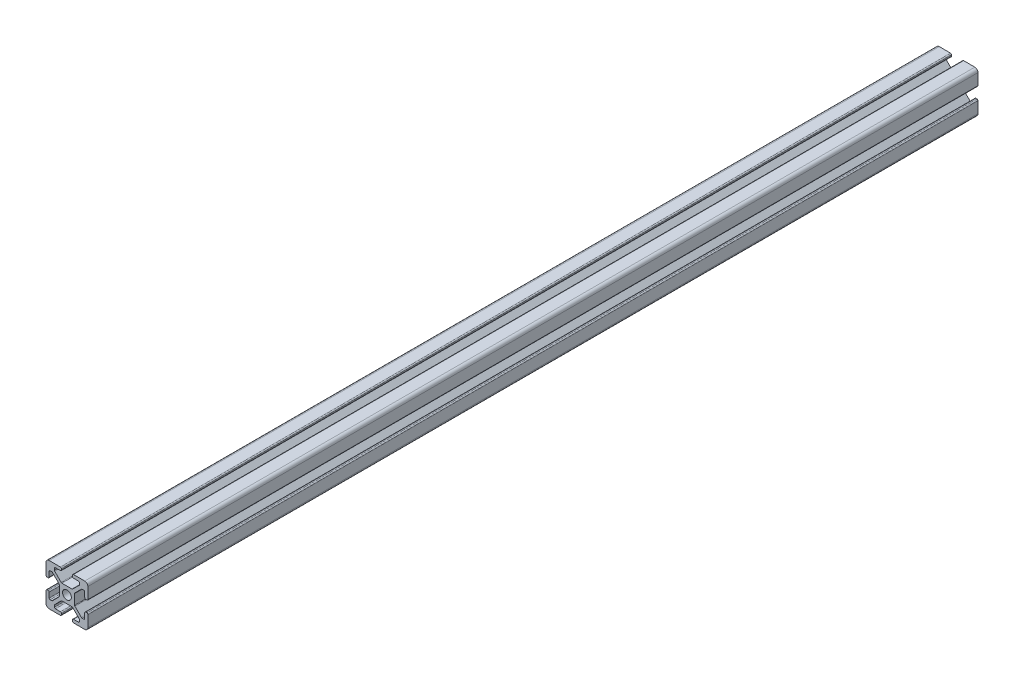
from build123d import *

# Parameters (mm, degrees)
SKETCH1_W           = 20
SKETCH1_H           = 20
BOSS_EXTRUDE1_DEPTH = 425
CUT_EXTRUDE1_DEPTH  = 426.23522902
FILLET1_R           = 0.5
CIRPATTERN1_START   = -425
CIRPATTERN1_DEPTH   = 425
FILLET2_R           = 1.5
SKETCH3_R           = 2.095
CUT_EXTRUDE2_DEPTH  = 426.23522902
FILLET3_R           = 0.5


# Read off the part's stored shape, not the designer's step: CirPattern1
with BuildPart() as part:
    # Sketch1 → Boss-Extrude1 (new body)
    with BuildSketch(Plane.XY):
        Rectangle(SKETCH1_W, SKETCH1_H)
    extrude(amount=-BOSS_EXTRUDE1_DEPTH)

    # Sketch2 → Cut-Extrude1 (cut, through all)
    with BuildSketch(Plane.XY):
        Polygon((0, 10), (-2.63, 10), (-2.63, 8.5), (-5.995, 8.5), (-5.995, 7.055660172), (-2.594339828, 3.655), (2.594339828, 3.655), (5.995, 7.055660172), (5.995, 8.5), (2.63, 8.5), (2.63, 10), align=None)
    extrude(amount=-CUT_EXTRUDE1_DEPTH, mode=Mode.SUBTRACT)

    # Fillet1
    fillet1_edges = [part.edges().sort_by_distance(p)[0] for p in [
        (2.63, 10, -212.5),
        (2.63, 8.5, -212.5),
        (5.995, 8.5, -212.5),
        (5.995, 7.055660172, -212.5),
        (2.594339828, 3.655, -212.5),
        (-2.594339828, 3.655, -212.5),
        (-5.995, 7.055660172, -212.5),
        (-5.995, 8.5, -212.5),
        (-2.63, 8.5, -212.5),
        (-2.63, 10, -212.5),
    ]]
    fillet(fillet1_edges, radius=FILLET1_R)

    # CirPattern1 outline → CirPattern1 (cut)
    with BuildSketch(Plane.XY.offset(CIRPATTERN1_START)):
        with BuildLine():
            Line((-2.63, -10), (2.63, -10))
            Line((2.63, -10), (2.63, -9))
            ThreePointArc((2.63, -9), (2.776446609, -8.646446609), (3.13, -8.5))
            Line((3.13, -8.5), (5.495, -8.5))
            ThreePointArc((5.495, -8.5), (5.848553391, -8.353553391), (5.995, -8))
            Line((5.995, -8), (5.995, -7.262766953))
            ThreePointArc((5.995, -7.262766953), (5.956939766, -7.071425237), (5.848553391, -6.909213562))
            Line((5.848553391, -6.909213562), (2.740786438, -3.801446609))
            ThreePointArc((2.740786438, -3.801446609), (2.578574763, -3.693060234), (2.387233047, -3.655))
            Line((2.387233047, -3.655), (-2.387233047, -3.655))
            ThreePointArc((-2.387233047, -3.655), (-2.578574763, -3.693060234), (-2.740786438, -3.801446609))
            Line((-2.740786438, -3.801446609), (-5.848553391, -6.909213562))
            ThreePointArc((-5.848553391, -6.909213562), (-5.956939766, -7.071425237), (-5.995, -7.262766953))
            Line((-5.995, -7.262766953), (-5.995, -8))
            ThreePointArc((-5.995, -8), (-5.848553391, -8.353553391), (-5.495, -8.5))
            Line((-5.495, -8.5), (-3.13, -8.5))
            ThreePointArc((-3.13, -8.5), (-2.776446609, -8.646446609), (-2.63, -9))
            Line((-2.63, -9), (-2.63, -10))
        make_face()
        with BuildLine():
            Line((-10, 2.63), (-10, -2.63))
            Line((-10, -2.63), (-9, -2.63))
            ThreePointArc((-9, -2.63), (-8.646446609, -2.776446609), (-8.5, -3.13))
            Line((-8.5, -3.13), (-8.5, -5.495))
            ThreePointArc((-8.5, -5.495), (-8.353553391, -5.848553391), (-8, -5.995))
            Line((-8, -5.995), (-7.262766953, -5.995))
            ThreePointArc((-7.262766953, -5.995), (-7.071425237, -5.956939766), (-6.909213562, -5.848553391))
            Line((-6.909213562, -5.848553391), (-3.801446609, -2.740786438))
            ThreePointArc((-3.801446609, -2.740786438), (-3.693060234, -2.578574763), (-3.655, -2.387233047))
            Line((-3.655, -2.387233047), (-3.655, 2.387233047))
            ThreePointArc((-3.655, 2.387233047), (-3.693060234, 2.578574763), (-3.801446609, 2.740786438))
            Line((-3.801446609, 2.740786438), (-6.909213562, 5.848553391))
            ThreePointArc((-6.909213562, 5.848553391), (-7.071425237, 5.956939766), (-7.262766953, 5.995))
            Line((-7.262766953, 5.995), (-8, 5.995))
            ThreePointArc((-8, 5.995), (-8.353553391, 5.848553391), (-8.5, 5.495))
            Line((-8.5, 5.495), (-8.5, 3.13))
            ThreePointArc((-8.5, 3.13), (-8.646446609, 2.776446609), (-9, 2.63))
            Line((-9, 2.63), (-10, 2.63))
        make_face()
        with BuildLine():
            Line((9, -2.63), (10, -2.63))
            Line((10, -2.63), (10, 2.63))
            Line((10, 2.63), (9, 2.63))
            ThreePointArc((9, 2.63), (8.646446609, 2.776446609), (8.5, 3.13))
            Line((8.5, 3.13), (8.5, 5.495))
            ThreePointArc((8.5, 5.495), (8.353553391, 5.848553391), (8, 5.995))
            Line((8, 5.995), (7.262766953, 5.995))
            ThreePointArc((7.262766953, 5.995), (7.071425237, 5.956939766), (6.909213562, 5.848553391))
            Line((6.909213562, 5.848553391), (3.801446609, 2.740786438))
            ThreePointArc((3.801446609, 2.740786438), (3.693060234, 2.578574763), (3.655, 2.387233047))
            Line((3.655, 2.387233047), (3.655, -2.387233047))
            ThreePointArc((3.655, -2.387233047), (3.693060234, -2.578574763), (3.801446609, -2.740786438))
            Line((3.801446609, -2.740786438), (6.909213562, -5.848553391))
            ThreePointArc((6.909213562, -5.848553391), (7.071425237, -5.956939766), (7.262766953, -5.995))
            Line((7.262766953, -5.995), (8, -5.995))
            ThreePointArc((8, -5.995), (8.353553391, -5.848553391), (8.5, -5.495))
            Line((8.5, -5.495), (8.5, -3.13))
            ThreePointArc((8.5, -3.13), (8.646446609, -2.776446609), (9, -2.63))
        make_face()
    extrude(amount=CIRPATTERN1_DEPTH, mode=Mode.SUBTRACT)

    # Fillet2
    fillet2_edges = [part.edges().sort_by_distance(p)[0] for p in [
        (10, -10, -212.5),
        (-10, -10, -212.5),
        (-10, 10, -212.5),
        (10, 10, -212.5),
    ]]
    fillet(fillet2_edges, radius=FILLET2_R)

    # Sketch3 → Cut-Extrude2 (cut, through all)
    with BuildSketch(Plane.XY):
        Circle(SKETCH3_R)
    extrude(amount=-CUT_EXTRUDE2_DEPTH, mode=Mode.SUBTRACT)

    # Fillet3
    fillet3_edges = [part.edges().sort_by_distance(p)[0] for p in [
        (-10, 2.63, -212.5),
        (-10, -2.63, -212.5),
        (-2.63, -10, -212.5),
        (2.63, -10, -212.5),
        (10, -2.63, -212.5),
        (10, 2.63, -212.5),
    ]]
    fillet(fillet3_edges, radius=FILLET3_R)


solid = part.part
